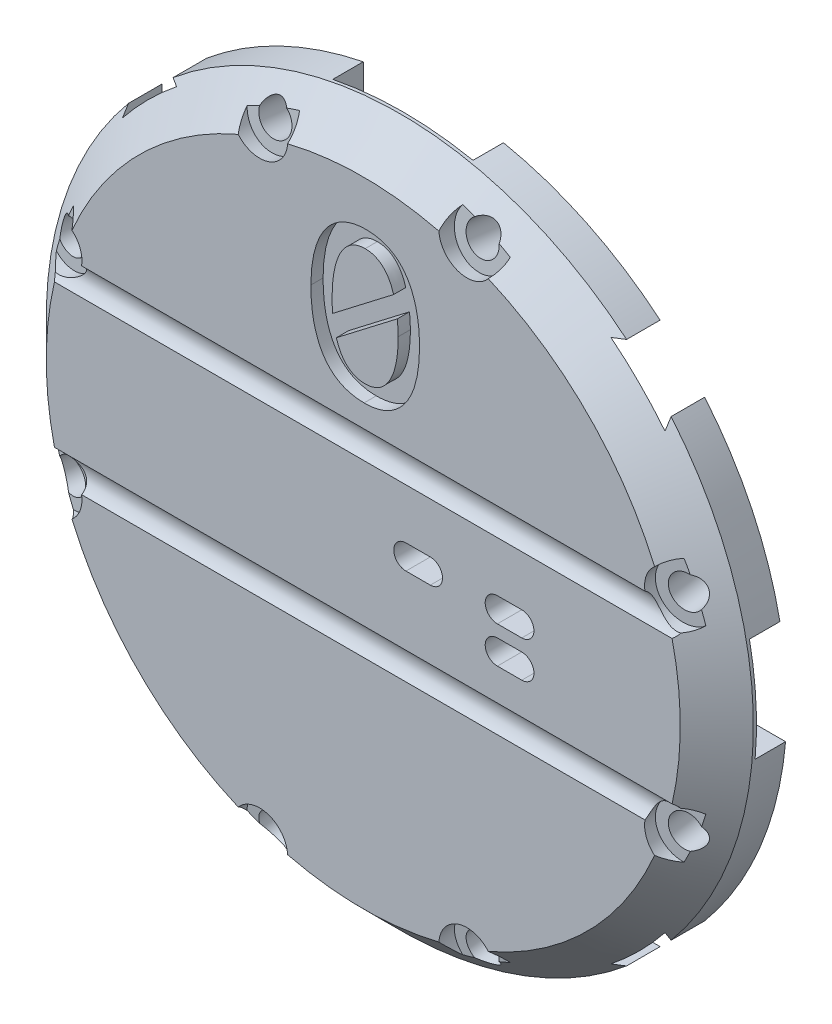
from build123d import *

# Parameters (mm, degrees)
SKETCH1_R               = 29
BOSS_EXTRUDE1_DEPTH     = 5.75
SKETCH3_W               = 44.5
SKETCH3_H               = 44.5
CUT_EXTRUDE1_DEPTH      = 3.25
CHAMFER2_SIZE           = 3
CUT_EXTRUDE5_DEPTH      = 42.413313077
CUT_EXTRUDE5_DEPTH_BACK = 42.413313077
SKETCH9_R               = 1.3
SKETCH10_W              = 11.5
SKETCH10_H              = 12.03351403
SKETCH10_W_2            = 12.03351403
SKETCH10_H_2            = 11.5
CUT_EXTRUDE6_DEPTH      = 2.5
SKETCH13_W              = 6.5
SKETCH13_H              = 6.5
CUT_EXTRUDE9_DEPTH      = 1.75
CHAMFER5_SIZE           = 1
SKETCH14_W              = 15.887507813
SKETCH14_H              = 11.6
CUT_EXTRUDE10_DEPTH     = 2.5
BOSS_EXTRUDE3_START     = 2.5
BOSS_EXTRUDE3_DEPTH     = 2.5
SKETCH17_R              = 1.35
CUT_EXTRUDE12_DEPTH     = 42.413313231
CUT_EXTRUDE13_START     = 20
SKETCH18_R              = 2.3
CUT_EXTRUDE13_DEPTH     = 12.5
CIRPATTERN1_COUNT       = 4
CUT_EXTRUDE14_DEPTH     = 42.413313231
BOSS_EXTRUDE2_DEPTH     = 2
FILLET1_R               = 1
CUT_EXTRUDE16_DEPTH     = 1


with BuildPart() as part:
    # Sketch1 → Boss-Extrude1 (new body)
    with BuildSketch(Plane.XY):
        Circle(SKETCH1_R)
    extrude(amount=BOSS_EXTRUDE1_DEPTH)

    # Sketch3 → Cut-Extrude1 (cut)
    with BuildSketch(Plane(origin=(0, 0, 0), x_dir=(-1, 0, 0), z_dir=(0, 0, -1))):
        Rectangle(SKETCH3_W, SKETCH3_H)
    extrude(amount=-CUT_EXTRUDE1_DEPTH, mode=Mode.SUBTRACT)

    # Chamfer2
    # the kernel refuses this chamfer: 3 mm, written as the material it takes off along each edge
    with BuildSketch(Plane(origin=(0, 0, 5.75), x_dir=(1, 0, 0), z_dir=(0, -1, 0))) as chamfer2_piece_1:
        Polygon((29, -CHAMFER2_SIZE), (29 - CHAMFER2_SIZE, 0), (29, 0), align=None)
    revolve(axis=Axis((0, 0, 5.75), (0, 0, 1)), mode=Mode.SUBTRACT)

    # Sketch9 → Cut-Extrude5 (cut, two sides: drawn at the far end of the back side and taken through both)
    with BuildSketch(Plane(origin=(0, 0, 0), x_dir=(0, 0, -1), z_dir=(1, 0, 0)).offset(-CUT_EXTRUDE5_DEPTH_BACK)):
        with Locations((-6.4, 7)):
            Circle(SKETCH9_R)
        with Locations((-6.4, -7)):
            Circle(SKETCH9_R)
    extrude(amount=CUT_EXTRUDE5_DEPTH + CUT_EXTRUDE5_DEPTH_BACK, mode=Mode.SUBTRACT)

    # Sketch10 → Cut-Extrude6 (cut)
    with BuildSketch(Plane(origin=(0, 0, 0), x_dir=(-1, 0, 0), z_dir=(0, 0, -1))):
        with Locations((0, -28.01742408)):
            Rectangle(SKETCH10_W, SKETCH10_H)
        with Locations((28.01742408, 0)):
            Rectangle(SKETCH10_W_2, SKETCH10_H_2)
        with Locations((-28.01742408, 0)):
            Rectangle(SKETCH10_W_2, SKETCH10_H_2)
        with Locations((0, 28.01742408)):
            Rectangle(SKETCH10_W, SKETCH10_H)
    extrude(amount=-CUT_EXTRUDE6_DEPTH, mode=Mode.SUBTRACT)

    # Sketch13 → Cut-Extrude9 (cut)
    with BuildSketch(Plane(origin=(0, 0, 3.25), x_dir=(-1, 0, 0), z_dir=(0, 0, -1))):
        with Locations((-18.9, 11.5)):
            Rectangle(SKETCH13_W, SKETCH13_H)
        with Locations((11.5, 18.9)):
            Rectangle(SKETCH13_W, SKETCH13_H)
        with Locations((18.9, -11.5)):
            Rectangle(SKETCH13_W, SKETCH13_H)
        with Locations((-11.5, -18.9)):
            Rectangle(SKETCH13_W, SKETCH13_H)
    extrude(amount=-CUT_EXTRUDE9_DEPTH, mode=Mode.SUBTRACT)

    # Chamfer5
    chamfer5_edges = [part.edges().sort_by_distance(p)[0] for p in [
        (18.9, 8.25, 3.25),
        (15.65, 11.5, 3.25),
        (18.9, 14.75, 3.25),
        (-8.25, 18.9, 3.25),
        (-11.5, 15.65, 3.25),
        (-14.75, 18.9, 3.25),
        (-18.9, -8.25, 3.25),
        (-15.65, -11.5, 3.25),
        (-18.9, -14.75, 3.25),
        (8.25, -18.9, 3.25),
        (11.5, -15.65, 3.25),
        (14.75, -18.9, 3.25),
    ]]
    chamfer(chamfer5_edges, length=CHAMFER5_SIZE)

    # Sketch14 → Cut-Extrude10 (cut)
    with BuildSketch(Plane(origin=(0, 0, 0), x_dir=(-1, 0, 0), z_dir=(0, 0, -1))):
        with Locations((-27.176000206, -5.8)):
            Rectangle(SKETCH14_W, SKETCH14_H)
    extrude(amount=-CUT_EXTRUDE10_DEPTH, mode=Mode.SUBTRACT)

    # Sketch23 → Boss-Extrude3 (add)
    with BuildSketch(Plane(origin=(0, 0, 2.5), x_dir=(-1, 0, 0), z_dir=(0, 0, -1)).offset(BOSS_EXTRUDE3_START)):
        with BuildLine():
            Line((-22.25, -2.55), (-28.88767038, -2.55))
            ThreePointArc((-28.88767038, -2.55), (-28.100032293, -7.168555302), (-26.578939031, -11.6))
            Line((-26.578939031, -11.6), (-22.25, -11.6))
            Line((-22.25, -11.6), (-22.25, -2.55))
        make_face()
    extrude(amount=-BOSS_EXTRUDE3_DEPTH)

    # Sketch17 → Cut-Extrude12 (cut, through all)
    with BuildSketch(Plane(origin=(0, 0, 0), x_dir=(0, -1, 0), z_dir=(0.1218693434051474, 0, 0.9925461516413221))):
        with Locations(Location((-8.5, 24.5, 0), (0, 0, 270))):
            Circle(SKETCH17_R)
        with Locations(Location((8.5, 24.5, 0), (0, 0, 270))):
            Circle(SKETCH17_R)
    cut_extrude12 = extrude(amount=CUT_EXTRUDE12_DEPTH, mode=Mode.SUBTRACT)

    # Sketch18 → Cut-Extrude13 (cut)
    with BuildSketch(Plane(origin=(0, 0, 0), x_dir=(0, -1, 0), z_dir=(0.1218693434051474, 0, 0.9925461516413221)).offset(CUT_EXTRUDE13_START)):
        with Locations((-8.5, 24.5)):
            Circle(SKETCH18_R)
        with Locations((8.5, 24.5)):
            Circle(SKETCH18_R)
    cut_extrude13 = extrude(amount=-CUT_EXTRUDE13_DEPTH, mode=Mode.SUBTRACT)

    # CirPattern1: Cut-Extrude12, Cut-Extrude13 ×4 about axis
    cirpattern1_axis = Axis((0, 0, 0), (0, 0, 1))
    add([cut_extrude12.rotate(cirpattern1_axis, i * 360 / CIRPATTERN1_COUNT) for i in range(1, CIRPATTERN1_COUNT)], mode=Mode.SUBTRACT)
    add([cut_extrude13.rotate(cirpattern1_axis, i * 360 / CIRPATTERN1_COUNT) for i in range(1, CIRPATTERN1_COUNT)], mode=Mode.SUBTRACT)

    # Sketch19 → Cut-Extrude14 (cut, through all)
    with BuildSketch(Plane.XY.offset(5.75)):
        with BuildLine():
            Line((3.5, 1.75), (5.5, 1.75))
            ThreePointArc((5.5, 1.75), (6.5, 0.75), (5.5, -0.25))
            Line((5.5, -0.25), (3.5, -0.25))
            ThreePointArc((3.5, -0.25), (2.5, 0.75), (3.5, 1.75))
        make_face()
        with BuildLine():
            Line((11, 1.75), (13, 1.75))
            ThreePointArc((13, 1.75), (14, 0.75), (13, -0.25))
            Line((13, -0.25), (11, -0.25))
            ThreePointArc((11, -0.25), (10, 0.75), (11, 1.75))
        make_face()
        with BuildLine():
            Line((11, -1.25), (13, -1.25))
            ThreePointArc((13, -1.25), (14, -2.25), (13, -3.25))
            Line((13, -3.25), (11, -3.25))
            ThreePointArc((11, -3.25), (10, -2.25), (11, -1.25))
        make_face()
    extrude(amount=-CUT_EXTRUDE14_DEPTH, mode=Mode.SUBTRACT)

    # Sketch21 → Boss-Extrude2 (add)
    # profile 1 of 2: a face of its own
    with BuildSketch(Plane(origin=(0, 0, 3.25), x_dir=(-1, 0, 0), z_dir=(0, 0, -1))):
        with BuildLine():
            Line((-5.5, -1.35), (-3.5, -1.35))
            ThreePointArc((-3.5, -1.35), (-1.4, 0.75), (-3.5, 2.85))
            Line((-3.5, 2.85), (-5.5, 2.85))
            ThreePointArc((-5.5, 2.85), (-7.6, 0.75), (-5.5, -1.35))
        make_face()
        with BuildLine():
            Line((-5.5, -0.35), (-3.5, -0.35))
            ThreePointArc((-3.5, -0.35), (-2.4, 0.75), (-3.5, 1.85))
            Line((-3.5, 1.85), (-5.5, 1.85))
            ThreePointArc((-5.5, 1.85), (-6.6, 0.75), (-5.5, -0.35))
        make_face(mode=Mode.SUBTRACT)
    # profile 2 of 2: a face of its own
    with BuildSketch(Plane(origin=(0, 0, 3.25), x_dir=(-1, 0, 0), z_dir=(0, 0, -1))):
        with BuildLine():
            Line((-11, 2.85), (-13, 2.85))
            ThreePointArc((-13, 2.85), (-14.94422221, 1.543725393), (-14.469693846, -0.75))
            ThreePointArc((-14.469693846, -0.75), (-14.94422221, -3.043725393), (-13, -4.35))
            Line((-13, -4.35), (-11, -4.35))
            ThreePointArc((-11, -4.35), (-9.05577779, -3.043725393), (-9.530306154, -0.75))
            ThreePointArc((-9.530306154, -0.75), (-9.05577779, 1.543725393), (-11, 2.85))
        make_face()
        with BuildLine():
            Line((-11, 1.85), (-13, 1.85))
            ThreePointArc((-13, 1.85), (-14.1, 0.75), (-13, -0.35))
            Line((-13, -0.35), (-11, -0.35))
            ThreePointArc((-11, -0.35), (-9.9, 0.75), (-11, 1.85))
        make_face(mode=Mode.SUBTRACT)
        with BuildLine():
            Line((-11, -1.15), (-13, -1.15))
            ThreePointArc((-13, -1.15), (-14.1, -2.25), (-13, -3.35))
            Line((-13, -3.35), (-11, -3.35))
            ThreePointArc((-11, -3.35), (-9.9, -2.25), (-11, -1.15))
        make_face(mode=Mode.SUBTRACT)
    extrude(amount=BOSS_EXTRUDE2_DEPTH)

    # Fillet1
    # the kernel refuses this fillet: 1 mm, written as the material it adds along each edge
    with BuildSketch(Plane(origin=(5.5, 0.75, 3.25), x_dir=(0, 1, 0), z_dir=(-1, 0, 0))) as fillet1_piece_1:
        with BuildLine():
            CenterArc((2.1 + FILLET1_R, FILLET1_R), FILLET1_R, 180, 90)
            Line((2.1, FILLET1_R), (2.1, 0))
            Line((2.1, 0), (2.1 + FILLET1_R, 0))
        make_face()
    revolve(axis=Axis((5.5, 0.75, 3.25), (0, 0, -1)), revolution_arc=180)
    with BuildSketch(Plane(origin=(5.5, -1.35, 3.25), x_dir=(0, -1, 0), z_dir=(-1, 0, 0)), Plane(origin=(3.5, 2.85, 3.25), x_dir=(0, 1, 0), z_dir=(1, 0, 0)), Plane(origin=(11, 2.85, 3.25), x_dir=(0, 1, 0), z_dir=(1, 0, 0)), Plane(origin=(13, -4.35, 3.25), x_dir=(0, -1, 0), z_dir=(-1, 0, 0))) as fillet1_piece_2:
        with BuildLine():
            CenterArc((FILLET1_R, -FILLET1_R), FILLET1_R, 90, 90)
            Line((0, -FILLET1_R), (0, 0))
            Line((0, 0), (FILLET1_R, 0))
        make_face()
    extrude(amount=2)
    with BuildSketch(Plane(origin=(3.5, 0.75, 3.25), x_dir=(0, -1, 0), z_dir=(1, 0, 0))) as fillet1_piece_3:
        with BuildLine():
            CenterArc((2.1 + FILLET1_R, FILLET1_R), FILLET1_R, 180, 90)
            Line((2.1, FILLET1_R), (2.1, 0))
            Line((2.1, 0), (2.1 + FILLET1_R, 0))
        make_face()
    revolve(axis=Axis((3.5, 0.75, 3.25), (0, 0, -1)), revolution_arc=180)
    with BuildSketch(Plane(origin=(11, 0.75, 3.25), x_dir=(0.40444193426076636, -0.9145636783797013, 0), z_dir=(0.9145636783797013, 0.40444193426076636, 0))) as fillet1_piece_4_section:
        with BuildLine():
            CenterArc((2.1 + FILLET1_R, FILLET1_R), FILLET1_R, 180, 90)
            Line((2.1, FILLET1_R), (2.1, 0))
            Line((2.1, 0), (2.1 + FILLET1_R, 0))
        make_face()
    fillet1_piece_4 = revolve(axis=Axis((11, 0.75, 3.25), (0, 0, -1)), revolution_arc=203.856160599, mode=Mode.PRIVATE)
    fillet1_piece_4 = fillet1_piece_4 - Plane(origin=(11, -2.25, 3.235400446), x_dir=(0, -1, 0), z_dir=(0, 0, 1)) * Cylinder(2.1, 13, mode=Mode.PRIVATE)
    add(fillet1_piece_4)
    with BuildSketch(Plane(origin=(13, 0.75, 3.25), x_dir=(0, 1, 0), z_dir=(-1, 0, 0))) as fillet1_piece_5_section:
        with BuildLine():
            CenterArc((2.1 + FILLET1_R, FILLET1_R), FILLET1_R, 180, 90)
            Line((2.1, FILLET1_R), (2.1, 0))
            Line((2.1, 0), (2.1 + FILLET1_R, 0))
        make_face()
    fillet1_piece_5 = revolve(axis=Axis((13, 0.75, 3.25), (0, 0, -1)), revolution_arc=203.856160599, mode=Mode.PRIVATE)
    fillet1_piece_5 = fillet1_piece_5 - Plane(origin=(13, -2.25, 3.087222706), x_dir=(0.6998542122237646, 0.7142857142857147, 0), z_dir=(0, 0, 1)) * Cylinder(2.1, 13, mode=Mode.PRIVATE)
    add(fillet1_piece_5)
    with BuildSketch(Plane(origin=(13, -2.25, 3.25), x_dir=(-0.40444193426076763, 0.9145636783797009, 0), z_dir=(-0.9145636783797009, -0.40444193426076763, 0))) as fillet1_piece_6_section:
        with BuildLine():
            CenterArc((2.1 + FILLET1_R, FILLET1_R), FILLET1_R, 180, 90)
            Line((2.1, FILLET1_R), (2.1, 0))
            Line((2.1, 0), (2.1 + FILLET1_R, 0))
        make_face()
    fillet1_piece_6 = revolve(axis=Axis((13, -2.25, 3.25), (0, 0, -1)), revolution_arc=203.856160599, mode=Mode.PRIVATE)
    fillet1_piece_6 = fillet1_piece_6 - Plane(origin=(13, 0.75, 3.235400446), x_dir=(0, 1, 0), z_dir=(0, 0, 1)) * Cylinder(2.1, 13, mode=Mode.PRIVATE)
    add(fillet1_piece_6)
    with BuildSketch(Plane(origin=(11, -2.25, 3.25), x_dir=(0, -1, 0), z_dir=(1, 0, 0))) as fillet1_piece_7_section:
        with BuildLine():
            CenterArc((2.1 + FILLET1_R, FILLET1_R), FILLET1_R, 180, 90)
            Line((2.1, FILLET1_R), (2.1, 0))
            Line((2.1, 0), (2.1 + FILLET1_R, 0))
        make_face()
    fillet1_piece_7 = revolve(axis=Axis((11, -2.25, 3.25), (0, 0, -1)), revolution_arc=203.856160599, mode=Mode.PRIVATE)
    fillet1_piece_7 = fillet1_piece_7 - Plane(origin=(11, 0.75, 3.087222706), x_dir=(-0.6998542122237651, -0.7142857142857144, 0), z_dir=(0, 0, 1)) * Cylinder(2.1, 13, mode=Mode.PRIVATE)
    add(fillet1_piece_7)

    # Sketch24 → Cut-Extrude16 (cut)
    with BuildSketch(Plane.XY.offset(5.75)):
        with BuildLine():
            add(Edge.make_bspline(
                [(4.61211941, 16.170450521), (4.609629847, 15.944710661), (4.604753386, 15.502540156), (4.5474431, 14.855747051), (4.461834353, 14.238402943), (4.339569969, 13.652833419), (4.184435004, 13.101054198), (3.985267501, 12.58976335), (3.755527346, 12.116733529), (3.48713078, 11.685448982), (3.183653033, 11.298830964), (2.844863255, 10.956051233), (2.470202852, 10.660423402), (2.059568041, 10.412999717), (1.614490849, 10.213057971), (1.129845793, 10.076559514), (0.609812084, 9.988743691), (0.25038528, 9.979838517), (0.065336217, 9.975253733)],
                knots=[0, 0, 0, 0, 1.248871528, 2.446241243, 3.590357027, 4.69618527, 5.754202854, 6.758290001, 7.728669934, 8.660396172, 9.563796911, 10.443071522, 11.321307858, 12.197637495, 13.090115231, 14.012601613, 14.976798049, 16, 16, 16, 16], degree=3))
            add(Edge.make_bspline(
                [(0.065336217, 9.975253733), (-0.095009986, 9.979157064), (-0.410839977, 9.986845358), (-0.873176697, 10.056194869), (-1.312758847, 10.171936701), (-1.730384642, 10.328642103), (-2.12104236, 10.538148865), (-2.482674643, 10.796422121), (-2.816831896, 11.102205137), (-3.117803226, 11.460864468), (-3.388575826, 11.86875509), (-3.623464032, 12.33033077), (-3.826539278, 12.841315562), (-3.999911714, 13.403819828), (-4.130762705, 14.020606741), (-4.229063227, 14.689502725), (-4.285631541, 15.41258653), (-4.292374342, 15.911990637), (-4.295863988, 16.170450521)],
                knots=[0, 0, 0, 0, 0.897102697, 1.767001224, 2.609309556, 3.43771295, 4.257811968, 5.082953918, 5.919052252, 6.786174452, 7.6970727, 8.653553743, 9.679470751, 10.771494031, 11.944028827, 13.204944144, 14.553456404, 16, 16, 16, 16], degree=3))
            add(Edge.make_bspline(
                [(-4.295863988, 16.170450521), (-4.291796106, 16.396146108), (-4.283813508, 16.83903925), (-4.233047824, 17.488264024), (-4.14258563, 18.107103849), (-4.018386797, 18.693789118), (-3.858208569, 19.246227744), (-3.662549083, 19.759570194), (-3.433020668, 20.23275539), (-3.167598633, 20.66461996), (-2.865470038, 21.052747666), (-2.525748193, 21.395613482), (-2.150834305, 21.6922239), (-1.737706369, 21.938770374), (-1.290753387, 22.138279627), (-0.806278818, 22.274977128), (-0.289021583, 22.362965532), (0.067688601, 22.371949287), (0.250919205, 22.376563954)],
                knots=[0, 0, 0, 0, 1.248165713, 2.449334701, 3.598380242, 4.704508407, 5.763215836, 6.776019403, 7.739017366, 8.667464557, 9.574217704, 10.452902578, 11.330549874, 12.210601904, 13.107080692, 14.028948355, 14.987533857, 16, 16, 16, 16], degree=3))
            add(Edge.make_bspline(
                [(0.250919205, 22.376563954), (0.411269181, 22.372660629), (0.727106604, 22.364972345), (1.188517072, 22.295753627), (1.627789233, 22.18029158), (2.043744989, 22.018946136), (2.436535735, 21.812746675), (2.797205806, 21.551596472), (3.130472077, 21.244113249), (3.430647106, 20.883070242), (3.702412373, 20.47370193), (3.939457778, 20.01310548), (4.140595821, 19.50024029), (4.311854836, 18.93834067), (4.448443999, 18.322627028), (4.544926285, 17.654041974), (4.602069238, 16.930160011), (4.608688101, 16.429828958), (4.61211941, 16.170450521)],
                knots=[0, 0, 0, 0, 0.896490568, 1.765795528, 2.602608418, 3.432274242, 4.256303472, 5.076742829, 5.915718828, 6.786140009, 7.696416714, 8.659101079, 9.677705081, 10.773848187, 11.941709476, 13.20176442, 14.549356535, 16, 16, 16, 16], degree=3))
        make_face()
        with BuildLine():
            add(Edge.make_bspline(
                [(2.865455999, 16.077659027), (2.864839005, 16.182323934), (2.863609324, 16.390923317), (2.840362021, 16.701771488), (2.82092987, 17.008594617), (2.801406756, 17.211212302), (2.791768636, 17.311240061)],
                knots=[0, 0, 0, 0, 1.015676625, 2.024265076, 3.024624451, 4, 4, 4, 4], degree=3))
            Line((2.791768636, 17.311240061), (-2.208055379, 13.468580556))
            add(Edge.make_bspline(
                [(-2.208055379, 13.468580556), (-2.15883924, 13.321137051), (-2.062306301, 13.031940146), (-1.876021988, 12.624239729), (-1.647689417, 12.260106137), (-1.373202208, 11.950099151), (-1.054058419, 11.70114286), (-0.756867451, 11.542285481), (-0.497626757, 11.456417233), (-0.289850061, 11.405797387), (-0.068113772, 11.380151789), (0.083478776, 11.375141757), (0.160856873, 11.372584462)],
                knots=[0, 0, 0, 0, 1.361870802, 2.671184605, 3.91877896, 5.116024374, 6.280451232, 7.450298556, 8.047911377, 8.670688444, 9.321473259, 10, 10, 10, 10], degree=3))
            add(Edge.make_bspline(
                [(0.160856873, 11.372584462), (0.261236207, 11.37605025), (0.459132471, 11.382882995), (0.747845416, 11.443326699), (1.023392987, 11.534783817), (1.282500154, 11.668912059), (1.526984601, 11.837213529), (1.747490888, 12.049106291), (1.955116864, 12.290390253), (2.139647736, 12.571150526), (2.305971243, 12.886730108), (2.453949566, 13.237943691), (2.577781922, 13.625580337), (2.680802736, 14.048969947), (2.765584334, 14.506147776), (2.824395418, 14.999278733), (2.860316703, 15.526735082), (2.863707249, 15.890195913), (2.865455999, 16.077659027)],
                knots=[0, 0, 0, 0, 0.796240393, 1.569775284, 2.332781704, 3.095240773, 3.878796528, 4.681173991, 5.516437293, 6.40201063, 7.34239963, 8.345981007, 9.424260963, 10.57011489, 11.804224653, 13.114209461, 14.5115885, 16, 16, 16, 16], degree=3))
        make_face(mode=Mode.SUBTRACT)
        with BuildLine():
            add(Edge.make_bspline(
                [(-2.549200577, 16.189554652), (-2.549314077, 16.092214042), (-2.549541082, 15.897528572), (-2.547848715, 15.607261836), (-2.538220317, 15.321297037), (-2.521814903, 15.133315979), (-2.513721476, 15.040577626)],
                knots=[0, 0, 0, 0, 1.015676347, 2.03139705, 3.028811753, 4, 4, 4, 4], degree=3))
            Line((-2.513721476, 15.040577626), (2.488831701, 18.883237131))
            add(Edge.make_bspline(
                [(2.488831701, 18.883237131), (2.441519721, 19.032928382), (2.34951335, 19.324029042), (2.154657958, 19.726475414), (1.932110388, 20.089680276), (1.657641813, 20.394726329), (1.347016239, 20.649855815), (1.050175177, 20.804573168), (0.796234371, 20.895771925), (0.592448081, 20.945854153), (0.377120221, 20.971599281), (0.230053591, 20.976662829), (0.15539855, 20.979233225)],
                knots=[0, 0, 0, 0, 1.387569518, 2.698370158, 3.946895934, 5.144331536, 6.312393877, 7.486406228, 8.084826247, 8.697958228, 9.339048001, 10, 10, 10, 10], degree=3))
            add(Edge.make_bspline(
                [(0.15539855, 20.979233225), (0.055054687, 20.975663768), (-0.142771643, 20.968626641), (-0.431442528, 20.909788248), (-0.705746907, 20.812659892), (-0.965915663, 20.678305819), (-1.210843072, 20.5062074), (-1.431927482, 20.290626753), (-1.642642062, 20.045358222), (-1.825741263, 19.755612591), (-1.992375785, 19.433461386), (-2.137705442, 19.074210804), (-2.260647813, 18.679364009), (-2.368655055, 18.249806697), (-2.448304665, 17.784320395), (-2.508444977, 17.284351538), (-2.543962845, 16.748640248), (-2.547418846, 16.379740037), (-2.549200577, 16.189554652)],
                knots=[0, 0, 0, 0, 0.786453526, 1.550480632, 2.299704824, 3.062398082, 3.840423392, 4.637837687, 5.478332318, 6.370910143, 7.318703432, 8.320397478, 9.40580758, 10.560070273, 11.791787257, 13.106920475, 14.508481623, 16, 16, 16, 16], degree=3))
        make_face(mode=Mode.SUBTRACT)
    extrude(amount=-CUT_EXTRUDE16_DEPTH, mode=Mode.SUBTRACT)


solid = part.part
